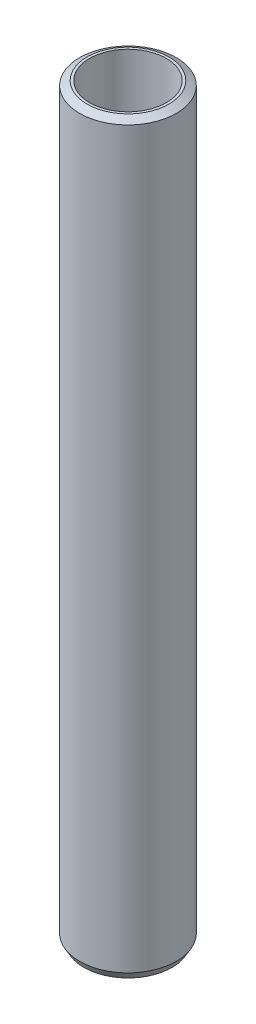
from build123d import *
from OCP.BRepFilletAPI import BRepFilletAPI_MakeChamfer

# Parameters (mm, degrees)
SKETCH1_R           = 35
BOSS_EXTRUDE1_DEPTH = 540.011191513
SKETCH2_R           = 27.774988587
CUT_EXTRUDE1_DEPTH  = 543.274918247
CHAMFER1_SIZE       = 3.112188528
CHAMFER1_SIZE2      = 5.395364258


with BuildPart() as part:
    # Sketch1 → Boss-Extrude1 (new body)
    with BuildSketch(Plane(origin=(0, 0, 0), x_dir=(1, 0, 0), z_dir=(0, 1, 0))):
        Circle(SKETCH1_R)
    extrude(amount=BOSS_EXTRUDE1_DEPTH)

    # Sketch2 → Cut-Extrude1 (cut, through all)
    with BuildSketch(Plane(origin=(0, 0, 0), x_dir=(1, 0, 0), z_dir=(0, 1, 0))):
        Circle(SKETCH2_R)
    extrude(amount=CUT_EXTRUDE1_DEPTH, mode=Mode.SUBTRACT)

    # Chamfer1: one chamfer whose edges measure the first distance from different faces: ONE call of the kernel's chamfer builder (chamfer() names one face for all edges)
    chamfer1_edges_1 = [part.edges().sort_by_distance(p)[0] for p in [
        (-35, 540.011191513, 0),
    ]]
    chamfer1_side_1 = [part.faces().sort_by_distance(p)[0] for p in [
        (-35, 270.005595757, 0),
    ]]
    chamfer1_edges_2 = [part.edges().sort_by_distance(p)[0] for p in [
        (-35, 0, 0),
    ]]
    chamfer1_side_2 = [part.faces().sort_by_distance(p)[0] for p in [
        (-34.010050506, 0, 0),
    ]]
    chamfer1 = BRepFilletAPI_MakeChamfer(part.part.solid().wrapped)
    for e in chamfer1_edges_1:
        chamfer1.Add(CHAMFER1_SIZE, CHAMFER1_SIZE2, e.wrapped, chamfer1_side_1[0].wrapped)  # the first distance lies on this face
    for e in chamfer1_edges_2:
        chamfer1.Add(CHAMFER1_SIZE, CHAMFER1_SIZE2, e.wrapped, chamfer1_side_2[0].wrapped)  # the first distance lies on this face
    add(Compound.cast(chamfer1.Shape()), mode=Mode.REPLACE)


solid = part.part
